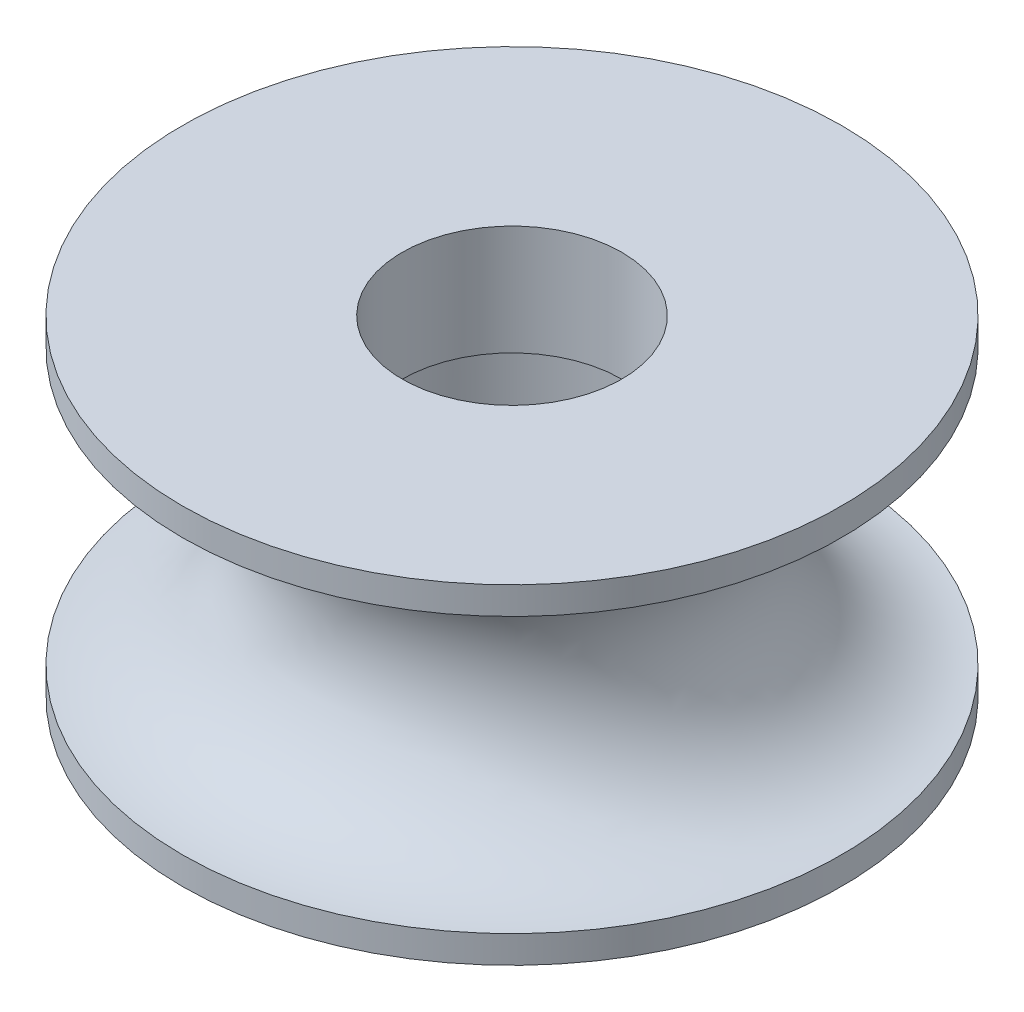
from build123d import *

# Parameters (mm, degrees)
SKETCH_9_W = 1
SKETCH_9_H = 4


with BuildPart() as part:
    # 草图7 → 旋转1 (revolve)
    with BuildSketch(Plane.XY):
        with BuildLine():
            Line((-5, 5), (-5, -5))
            Line((-5, -5), (-5, -6))
            Line((-5, -6), (-12, -6))
            Line((-12, -6), (-12, -5))
            ThreePointArc((-12, -5), (-7, 0), (-12, 5))
            Line((-12, 5), (-12, 6))
            Line((-12, 6), (-5, 6))
            Line((-5, 6), (-5, 5))
        make_face()
    revolve(axis=Axis((0, 0, 0), (0, 1, 0)))

    # 草图9 → 旋转2 (revolve)
    with BuildSketch(Plane.XY):
        with Locations((-4.5, 4)):
            Rectangle(SKETCH_9_W, SKETCH_9_H)
        with Locations((-4.5, -4)):
            Rectangle(SKETCH_9_W, SKETCH_9_H)
    revolve(axis=Axis((0, 0, 0), (0, 1, 0)))


solid = part.part
